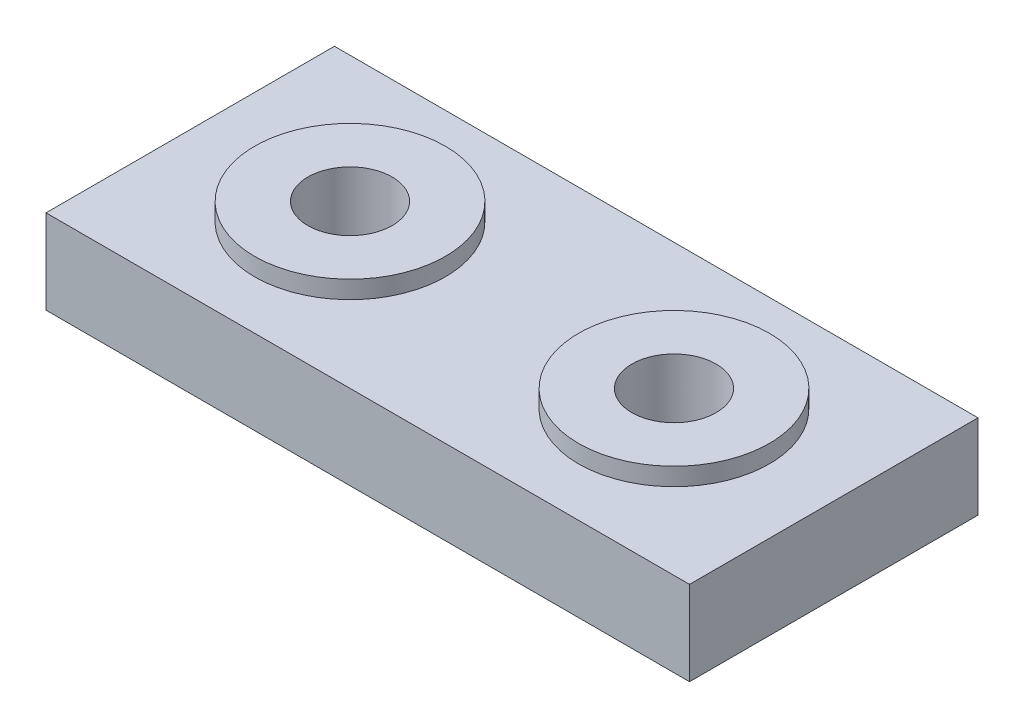
from build123d import *

# Parameters (mm, degrees)
SKETCH1_W           = 14.5
SKETCH1_H           = 6.5
BOSS_EXTRUDE1_DEPTH = 1.9
SHELL1_T            = -1.2
SKETCH2_R           = 2.15
SKETCH2_R_2         = 0.95
BOSS_EXTRUDE2_DEPTH = 0.4
CUT_EXTRUDE1_START  = -3.4
SKETCH3_R           = 0.95
CUT_EXTRUDE1_DEPTH  = 3.4
CUT_EXTRUDE2_START  = -3.4
SKETCH4_R           = 0.95
CUT_EXTRUDE2_DEPTH  = 3.4


with BuildPart() as part:
    # Sketch1 → Boss-Extrude1 (new body)
    with BuildSketch(Plane(origin=(0, 0, 0), x_dir=(1, 0, 0), z_dir=(0, 1, 0))):
        Rectangle(SKETCH1_W, SKETCH1_H)
    extrude(amount=BOSS_EXTRUDE1_DEPTH)

    # Shell1
    shell1_openings = [part.faces().sort_by_distance(p)[0] for p in [
        (0, 0, 0),
    ]]
    offset(amount=SHELL1_T, openings=shell1_openings, kind=Kind.INTERSECTION)

    # Sketch2 → Boss-Extrude2 (add)
    # profile 1 of 2: a face of its own
    with BuildSketch(Plane(origin=(0, 1.9, 0), x_dir=(1, 0, 0), z_dir=(0, 1, 0))):
        with Locations((-3.65, 0)):
            Circle(SKETCH2_R)
        with Locations((-3.65, 0)):
            Circle(SKETCH2_R_2, mode=Mode.SUBTRACT)
    # profile 2 of 2: a face of its own
    with BuildSketch(Plane(origin=(0, 1.9, 0), x_dir=(1, 0, 0), z_dir=(0, 1, 0))):
        with Locations((3.65, 0)):
            Circle(SKETCH2_R)
        with Locations((3.65, 0)):
            Circle(SKETCH2_R_2, mode=Mode.SUBTRACT)
    extrude(amount=BOSS_EXTRUDE2_DEPTH)

    # Sketch3 → Cut-Extrude1 (cut)
    with BuildSketch(Plane(origin=(0, 1.9, 0), x_dir=(1, 0, 0), z_dir=(0, 1, 0)).offset(CUT_EXTRUDE1_START)):
        with Locations((-3.65, 0)):
            Circle(SKETCH3_R)
    extrude(amount=CUT_EXTRUDE1_DEPTH, mode=Mode.SUBTRACT)

    # Sketch4 → Cut-Extrude2 (cut)
    with BuildSketch(Plane(origin=(0, 1.9, 0), x_dir=(1, 0, 0), z_dir=(0, 1, 0)).offset(CUT_EXTRUDE2_START)):
        with Locations((3.65, 0)):
            Circle(SKETCH4_R)
    extrude(amount=CUT_EXTRUDE2_DEPTH, mode=Mode.SUBTRACT)


solid = part.part
